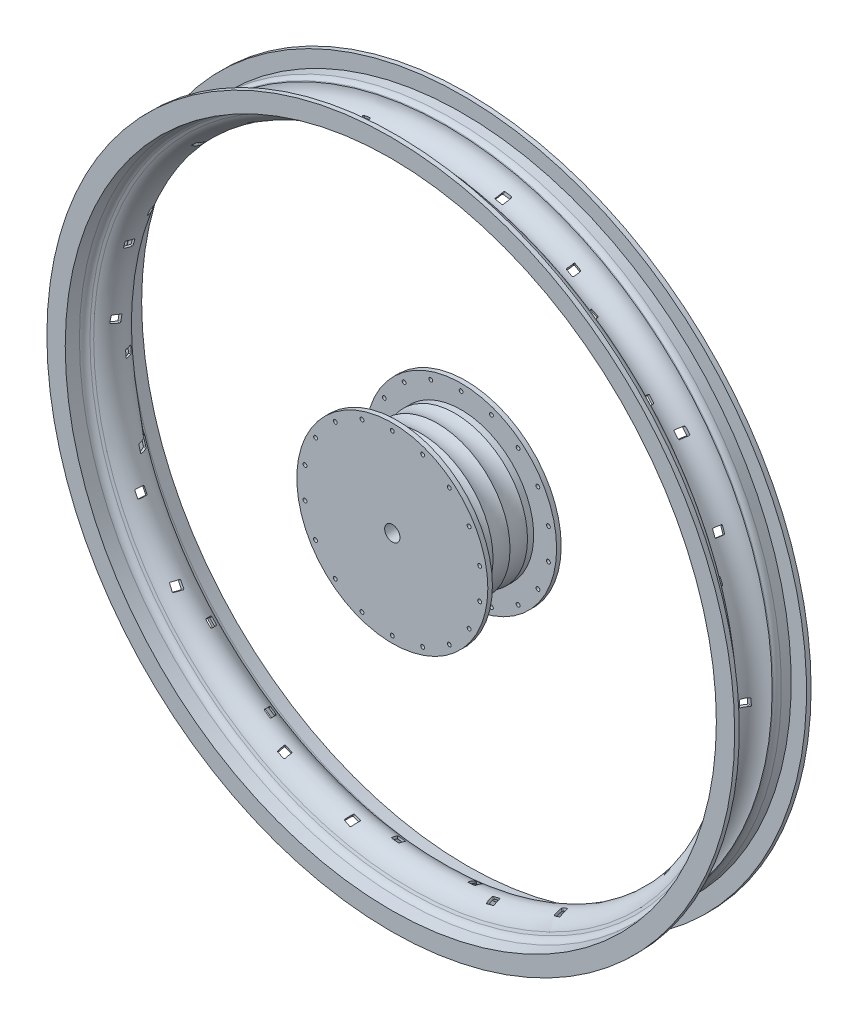
from build123d import *

# Parameters (mm, degrees)
SKETCH_1_R               = 47.5
EXTRUDE_1_DEPTH          = 21
SKETCH_4_R               = 5
CUT_EXTRUDE_1_DEPTH      = 42
EXTRUDE_START            = 3
SKETCH_5_R               = 62.5
SKETCH_5_R_2             = 5
EXTRUDE_3_DEPTH          = 3
SKETCH_8_R               = 1.25
CUT_EXTRUDE_3_DEPTH      = 3
SKETCH_9_R               = 225
SKETCH_9_R_2             = 213
EXTRUDE_4_DEPTH          = 25
CUT_EXTRUDE_5_DEPTH      = 100
CUT_EXTRUDE_6_DEPTH      = 100
CUT_EXTRUDE_7_DEPTH      = 97
CUT_EXTRUDE_8_DEPTH      = 97
PATTERN_CIRCULAR_1_COUNT = 9


with BuildPart() as part:
    # Эскиз1 → Бобышка-Вытянуть1 (new, symmetric)
    with BuildSketch(Plane.XY):
        with Locations(Location((0, 0, 0), (0, 0, 180))):
            Circle(SKETCH_1_R)
    extrude(amount=EXTRUDE_1_DEPTH, both=True)

    # Эскиз3 → Вырез-Повернуть1 (revolve, cut)
    with BuildSketch(Plane(origin=(0, 0, 0), x_dir=(0, 0, -1), z_dir=(1, 0, 0)), mode=Mode.PRIVATE) as cut_revolve_1_sk:
        with BuildLine():
            ThreePointArc((-5.553336501, 47.463528753), (0, 46.397675792), (5.553336501, 47.463528753))
            ThreePointArc((5.553336501, 47.463528753), (26.201277199, 61.308527049), (5.648027523, 75.293710662))
            ThreePointArc((5.648027523, 75.293710662), (0, 76.397675792), (-5.648027523, 75.293710662))
            ThreePointArc((-5.648027523, 75.293710662), (-26.201277199, 61.308527049), (-5.553336501, 47.463528753))
        make_face()
    revolve(cut_revolve_1_sk.sketch.rotate(Axis((0, 0, 18.723953922), (0, 0, -1)), 90), axis=Axis((0, 0, 18.723953922), (0, 0, -1)), mode=Mode.SUBTRACT)

    # Эскиз4 → Вырез-Вытянуть1 (cut)
    with BuildSketch(Plane.XY.offset(21)):
        Circle(SKETCH_4_R)
    extrude(amount=-CUT_EXTRUDE_1_DEPTH, mode=Mode.SUBTRACT)

    # Эскиз5 → Бобышка-Вытянуть3 (add)
    with BuildSketch(Plane.XY.offset(21).offset(EXTRUDE_START)):
        Circle(SKETCH_5_R)
        Circle(SKETCH_5_R_2, mode=Mode.SUBTRACT)
    extrude_3 = extrude(amount=-EXTRUDE_3_DEPTH)

    # Эскиз8 → Вырез-Вытянуть3 (cut)
    with BuildSketch(Plane.XY.offset(24)):
        with Locations((0, 58)):
            Circle(SKETCH_8_R)
        with Locations((19.837168313, 54.502172006)):
            Circle(SKETCH_8_R)
        with Locations((37.281681362, 44.430577701)):
            Circle(SKETCH_8_R)
        with Locations((50.229473419, 29)):
            Circle(SKETCH_8_R)
        with Locations((57.118849675, 10.071594305)):
            Circle(SKETCH_8_R)
        with Locations((57.118849675, -10.071594305)):
            Circle(SKETCH_8_R)
        with Locations((50.22947342, -29)):
            Circle(SKETCH_8_R)
        with Locations((37.281681362, -44.430577701)):
            Circle(SKETCH_8_R)
        with Locations((19.837168313, -54.502172006)):
            Circle(SKETCH_8_R)
        with Locations((0, -58)):
            Circle(SKETCH_8_R)
        with Locations((-19.837168313, -54.502172006)):
            Circle(SKETCH_8_R)
        with Locations((-37.281681362, -44.430577701)):
            Circle(SKETCH_8_R)
        with Locations((-50.229473419, -29)):
            Circle(SKETCH_8_R)
        with Locations((-57.118849675, -10.071594305)):
            Circle(SKETCH_8_R)
        with Locations((-57.118849675, 10.071594305)):
            Circle(SKETCH_8_R)
        with Locations((-50.229473419, 29)):
            Circle(SKETCH_8_R)
        with Locations((-37.281681362, 44.430577701)):
            Circle(SKETCH_8_R)
        with Locations((-19.837168313, 54.502172006)):
            Circle(SKETCH_8_R)
    cut_extrude_3 = extrude(amount=-CUT_EXTRUDE_3_DEPTH, mode=Mode.SUBTRACT)

    # Зеркальное отражение3: Бобышка-Вытянуть3, Вырез-Вытянуть3 across plane
    add(extrude_3.mirror(Plane.XY))
    add(cut_extrude_3.mirror(Plane.XY), mode=Mode.SUBTRACT)


with BuildPart() as body_2:
    # Эскиз9 → Бобышка-Вытянуть4 (new, symmetric)
    with BuildSketch(Plane.XY):
        Circle(SKETCH_9_R)
        Circle(SKETCH_9_R_2, mode=Mode.SUBTRACT)
    extrude(amount=EXTRUDE_4_DEPTH, both=True)

    # Эскиз10 → Повернуть1 (revolve)
    with BuildSketch(Plane(origin=(0, 0, 0), x_dir=(1, 0, 0), z_dir=(0, 1, 0))):
        with BuildLine():
            Line((-213, 25), (-213, -25))
            Line((-213, -25), (-212.11482468, -16.595159068))
            ThreePointArc((-212.11482468, -16.595159068), (-211.205254006, -14.204640778), (-209.232513009, -12.576700525))
            Line((-209.232513009, -12.576700525), (-207.565512376, -11.809586964))
            ThreePointArc((-207.565512376, -11.809586964), (-200, 0), (-207.565512376, 11.809586964))
            Line((-207.565512376, 11.809586964), (-209.232513009, 12.576700525))
            ThreePointArc((-209.232513009, 12.576700525), (-211.205254006, 14.204640778), (-212.11482468, 16.595159068))
            Line((-212.11482468, 16.595159068), (-213, 25))
        make_face()
    revolve(axis=Axis((0, 0, -30.513536679), (0, 0, 1)))

    # Эскиз11 → Вырез-Повернуть2 (revolve, cut)
    with BuildSketch(Plane(origin=(0, 0, 0), x_dir=(1, 0, 0), z_dir=(0, 1, 0))):
        with BuildLine():
            Line((-225, 22), (-215, 22))
            Line((-215, 22), (-215, 15.529882354))
            ThreePointArc((-215, 15.529882354), (-214.572344237, 13.506600816), (-213.362532728, 11.829426483))
            Line((-213.362532728, 11.829426483), (-213, 11.5))
            ThreePointArc((-213, 11.5), (-201.5, 0), (-213, -11.5))
            Line((-213, -11.5), (-213.362532728, -11.829426483))
            ThreePointArc((-213.362532728, -11.829426483), (-214.572344237, -13.506600816), (-215, -15.529882354))
            Line((-215, -15.529882354), (-215, -22))
            Line((-215, -22), (-225, -22))
            Line((-225, -22), (-225, 22))
        make_face()
    revolve(axis=Axis((0, 0, -37.108503341), (0, 0, 1)), mode=Mode.SUBTRACT)

    # Эскиз19 → Вырез-Вытянуть5 (cut)
    with BuildSketch(Plane(origin=(-58.644192004, 116.644192004, 14.672589669), x_dir=(0.10396126258317402, -0.1039612625831729, -0.9891330101478896), z_dir=(0.6994226589710382, -0.6994226589710316, 0.1470234275065545))):
        with BuildLine():
            Line((-2, -2.5), (2, -2.5))
            ThreePointArc((2, -2.5), (2.353553391, -2.353553391), (2.5, -2))
            Line((2.5, -2), (2.5, 2))
            ThreePointArc((2.5, 2), (2.353553391, 2.353553391), (2, 2.5))
            Line((2, 2.5), (-2, 2.5))
            ThreePointArc((-2, 2.5), (-2.353553391, 2.353553391), (-2.5, 2))
            Line((-2.5, 2), (-2.5, -2))
            ThreePointArc((-2.5, -2), (-2.353553391, -2.353553391), (-2, -2.5))
        make_face()
    cut_extrude_5 = extrude(amount=-CUT_EXTRUDE_5_DEPTH, mode=Mode.SUBTRACT)

    # Эскиз20 → Вырез-Вытянуть6 (cut)
    with BuildSketch(Plane(origin=(54.708019766, 112.708019766, -7), x_dir=(-0.7140775659295758, 0.6863305237689376, 0.13799870281690424), z_dir=(-0.7000665895728009, -0.7000665895728029, -0.1407605780316794))):
        with BuildLine():
            Line((-2, -2.5), (2, -2.5))
            ThreePointArc((2, -2.5), (2.353553391, -2.353553391), (2.5, -2))
            Line((2.5, -2), (2.5, 2))
            ThreePointArc((2.5, 2), (2.353553391, 2.353553391), (2, 2.5))
            Line((2, 2.5), (-2, 2.5))
            ThreePointArc((-2, 2.5), (-2.353553391, 2.353553391), (-2.5, 2))
            Line((-2.5, 2), (-2.5, -2))
            ThreePointArc((-2.5, -2), (-2.353553391, -2.353553391), (-2, -2.5))
        make_face()
    cut_extrude_6 = extrude(amount=-CUT_EXTRUDE_6_DEPTH, mode=Mode.SUBTRACT)

    # Эскиз25 → Вырез-Вытянуть7 (cut)
    with BuildSketch(Plane(origin=(97.157394056, 92.083579223, 5.736238464), x_dir=(0.12701413484713267, 0.06173507485424737, 0.9899778735314113), z_dir=(-0.8903760699597367, -0.43276626962464276, 0.14122255456627714))):
        with BuildLine():
            Line((-2, -2.5), (2, -2.5))
            ThreePointArc((2, -2.5), (2.353553391, -2.353553391), (2.5, -2))
            Line((2.5, -2), (2.5, 2))
            ThreePointArc((2.5, 2), (2.353553391, 2.353553391), (2, 2.5))
            Line((2, 2.5), (-2, 2.5))
            ThreePointArc((-2, 2.5), (-2.353553391, 2.353553391), (-2.5, 2))
            Line((-2.5, 2), (-2.5, -2))
            ThreePointArc((-2.5, -2), (-2.353553391, -2.353553391), (-2, -2.5))
        make_face()
    cut_extrude_7 = extrude(amount=-CUT_EXTRUDE_7_DEPTH, mode=Mode.SUBTRACT)

    # Эскиз26 → Вырез-Вытянуть8 (cut)
    with BuildSketch(Plane(origin=(-23.112496176, 146.608024735, -11.894212759), x_dir=(-0.9084352130977729, -0.41251467427001515, -0.06765432074825127), z_dir=(0.41802567337904495, -0.8964589495120349, -0.14702342750655475))):
        with BuildLine():
            Line((-2, -2.5), (2, -2.5))
            ThreePointArc((2, -2.5), (2.353553391, -2.353553391), (2.5, -2))
            Line((2.5, -2), (2.5, 2))
            ThreePointArc((2.5, 2), (2.353553391, 2.353553391), (2, 2.5))
            Line((2, 2.5), (-2, 2.5))
            ThreePointArc((-2, 2.5), (-2.353553391, 2.353553391), (-2.5, 2))
            Line((-2.5, 2), (-2.5, -2))
            ThreePointArc((-2.5, -2), (-2.353553391, -2.353553391), (-2, -2.5))
        make_face()
    cut_extrude_8 = extrude(amount=-CUT_EXTRUDE_8_DEPTH, mode=Mode.SUBTRACT)

    # Круговой массив1: Вырез-Вытянуть5, Вырез-Вытянуть6, Вырез-Вытянуть7, Вырез-Вытянуть8 ×9 about axis
    pattern_circular_1_axis = Axis((0, 0, 0), (0, 0, 1))
    add([cut_extrude_5.rotate(pattern_circular_1_axis, i * 360 / PATTERN_CIRCULAR_1_COUNT) for i in range(1, PATTERN_CIRCULAR_1_COUNT)], mode=Mode.SUBTRACT)
    add([cut_extrude_6.rotate(pattern_circular_1_axis, i * 360 / PATTERN_CIRCULAR_1_COUNT) for i in range(1, PATTERN_CIRCULAR_1_COUNT)], mode=Mode.SUBTRACT)
    add([cut_extrude_7.rotate(pattern_circular_1_axis, i * 360 / PATTERN_CIRCULAR_1_COUNT) for i in range(1, PATTERN_CIRCULAR_1_COUNT)], mode=Mode.SUBTRACT)
    add([cut_extrude_8.rotate(pattern_circular_1_axis, i * 360 / PATTERN_CIRCULAR_1_COUNT) for i in range(1, PATTERN_CIRCULAR_1_COUNT)], mode=Mode.SUBTRACT)


solid = Compound([part.part, body_2.part])
